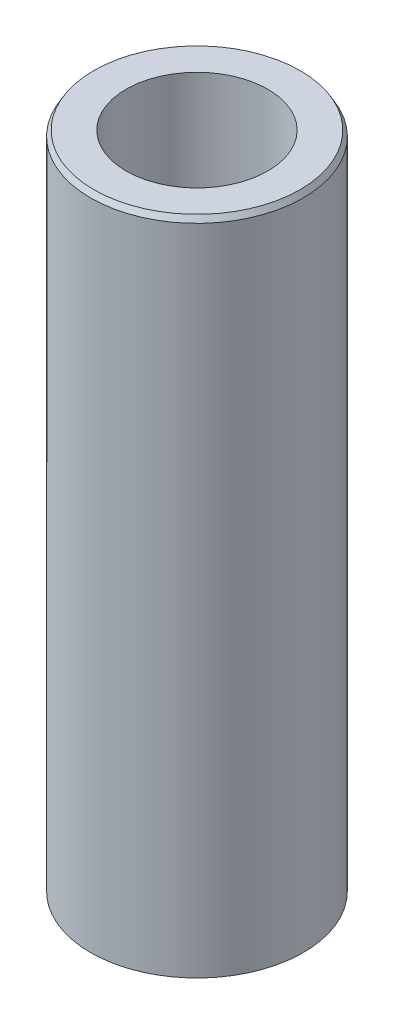
from build123d import *
from OCP.BRepFilletAPI import BRepFilletAPI_MakeChamfer

# Parameters (mm, degrees)
SKETCH1_R           = 37.5
BOSS_EXTRUDE1_DEPTH = 233.507473618
SKETCH2_R           = 24.984423996
CUT_EXTRUDE1_DEPTH  = 240.454046187
CHAMFER1_SIZE       = 1.956429327
CHAMFER1_SIZE2      = 1.129544998


with BuildPart() as part:
    # Sketch1 → Boss-Extrude1 (new body)
    with BuildSketch(Plane(origin=(0, 0, 0), x_dir=(1, 0, 0), z_dir=(0, 1, 0))):
        Circle(SKETCH1_R)
    extrude(amount=BOSS_EXTRUDE1_DEPTH)

    # Sketch2 → Cut-Extrude1 (cut, through all)
    with BuildSketch(Plane(origin=(0, 0, 0), x_dir=(1, 0, 0), z_dir=(0, 1, 0))):
        Circle(SKETCH2_R)
    extrude(amount=CUT_EXTRUDE1_DEPTH, mode=Mode.SUBTRACT)

    # Chamfer1: one chamfer whose edges measure the first distance from different faces: ONE call of the kernel's chamfer builder (chamfer() names one face for all edges)
    chamfer1_edges_1 = [part.edges().sort_by_distance(p)[0] for p in [
        (-37.5, 233.507473618, 0),
    ]]
    chamfer1_side_1 = [part.faces().sort_by_distance(p)[0] for p in [
        (-37.5, 116.753736809, 0),
    ]]
    chamfer1_edges_2 = [part.edges().sort_by_distance(p)[0] for p in [
        (-37.5, 0, 0),
    ]]
    chamfer1_side_2 = [part.faces().sort_by_distance(p)[0] for p in [
        (-36.439339828, 0, 0),
    ]]
    chamfer1 = BRepFilletAPI_MakeChamfer(part.part.solid().wrapped)
    for e in chamfer1_edges_1:
        chamfer1.Add(CHAMFER1_SIZE, CHAMFER1_SIZE2, e.wrapped, chamfer1_side_1[0].wrapped)  # the first distance lies on this face
    for e in chamfer1_edges_2:
        chamfer1.Add(CHAMFER1_SIZE, CHAMFER1_SIZE2, e.wrapped, chamfer1_side_2[0].wrapped)  # the first distance lies on this face
    add(Compound.cast(chamfer1.Shape()), mode=Mode.REPLACE)


solid = part.part
